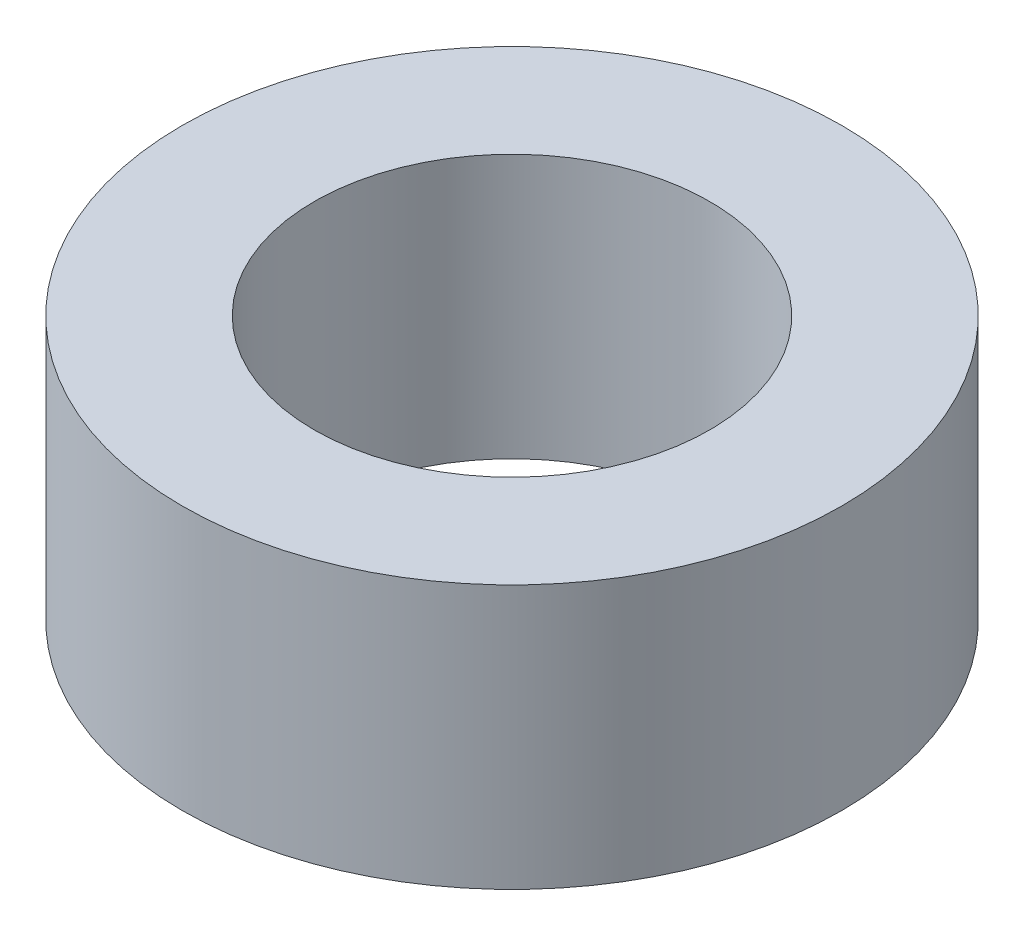
from build123d import *

# Parameters (mm, degrees)
SKETCH1_R           = 5
SKETCH1_R_2         = 3
BOSS_EXTRUDE1_DEPTH = 4


with BuildPart() as part:
    # Sketch1 → Boss-Extrude1 (new body)
    with BuildSketch(Plane(origin=(0, 0, 0), x_dir=(1, 0, 0), z_dir=(0, 1, 0))):
        Circle(SKETCH1_R)
        Circle(SKETCH1_R_2, mode=Mode.SUBTRACT)
    extrude(amount=BOSS_EXTRUDE1_DEPTH)


solid = part.part
